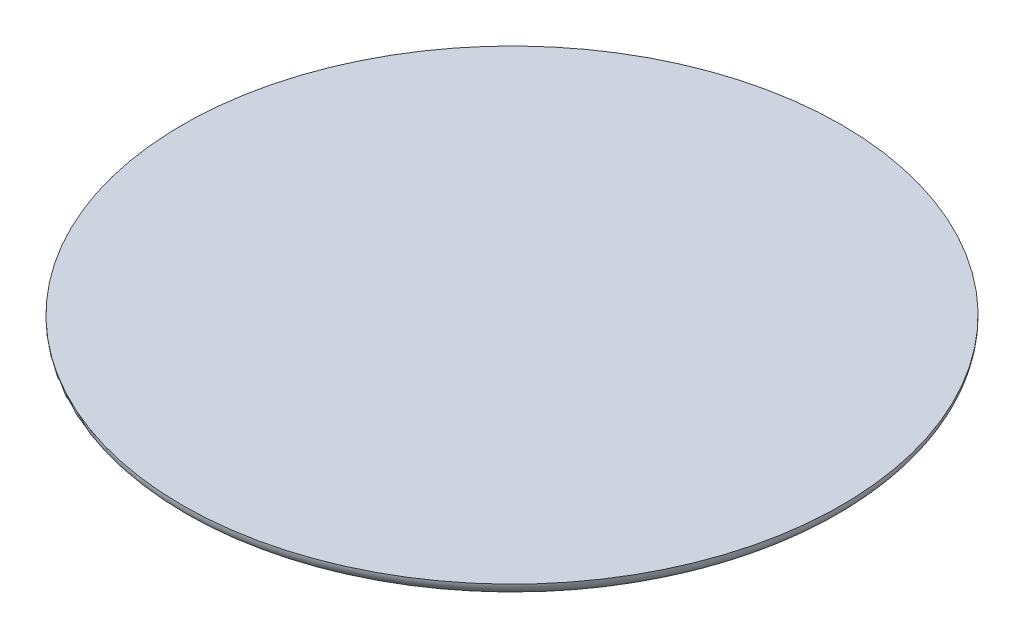
from build123d import *

# Parameters (mm, degrees)
SKETCH1_R           = 50
BOSS_EXTRUDE1_DEPTH = 2
FILLET1_R           = 2


with BuildPart() as part:
    # Sketch1 → Boss-Extrude1 (new body)
    with BuildSketch(Plane(origin=(0, 0, 0), x_dir=(1, 0, 0), z_dir=(0, 1, 0))):
        with Locations(Location((0, 0, 0), (0, 0, 270))):
            Circle(SKETCH1_R)
    extrude(amount=BOSS_EXTRUDE1_DEPTH)

    # Fillet1
    fillet1_edges = [part.edges().sort_by_distance(p)[0] for p in [
        (0, 0, -50),
    ]]
    fillet(fillet1_edges, radius=FILLET1_R - 0.0001)  # a hair under: the kernel refuses the full size


solid = part.part
